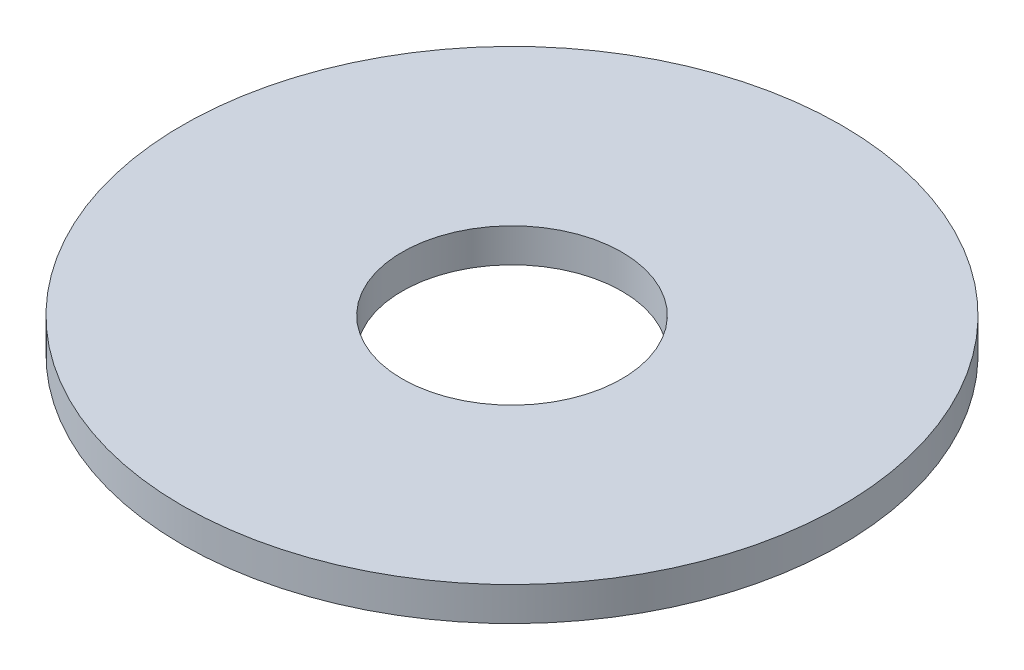
from build123d import *

# Parameters (mm, degrees)
SKETCH1_R           = 97.5
BOSS_EXTRUDE1_DEPTH = 10
SKETCH2_R           = 32.5
CUT_EXTRUDE1_DEPTH  = 139.247965627


with BuildPart() as part:
    # Sketch1 → Boss-Extrude1 (new body)
    with BuildSketch(Plane(origin=(0, 0, 0), x_dir=(1, 0, 0), z_dir=(0, 1, 0))):
        Circle(SKETCH1_R)
    extrude(amount=BOSS_EXTRUDE1_DEPTH)

    # Sketch2 → Cut-Extrude1 (cut, through all)
    with BuildSketch(Plane(origin=(0, 0, 0), x_dir=(1, 0, 0), z_dir=(0, 1, 0))):
        Circle(SKETCH2_R)
    extrude(amount=CUT_EXTRUDE1_DEPTH, mode=Mode.SUBTRACT)


solid = part.part
